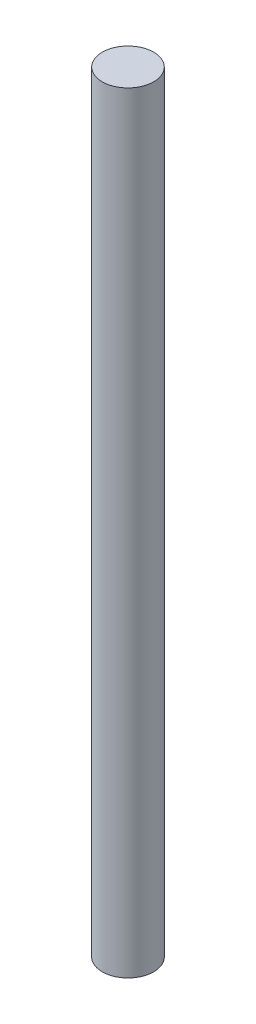
from build123d import *

# Parameters (mm, degrees)
SKETCH_1_R      = 2.5
EXTRUDE_1_DEPTH = 37.5


with BuildPart() as part:
    # ｽｹｯﾁ1 → ﾎﾞｽ - 押し出し1 (new, symmetric)
    with BuildSketch(Plane(origin=(0, 0, 0), x_dir=(1, 0, 0), z_dir=(0, 1, 0))):
        Circle(SKETCH_1_R)
    extrude(amount=EXTRUDE_1_DEPTH, both=True)


solid = part.part
